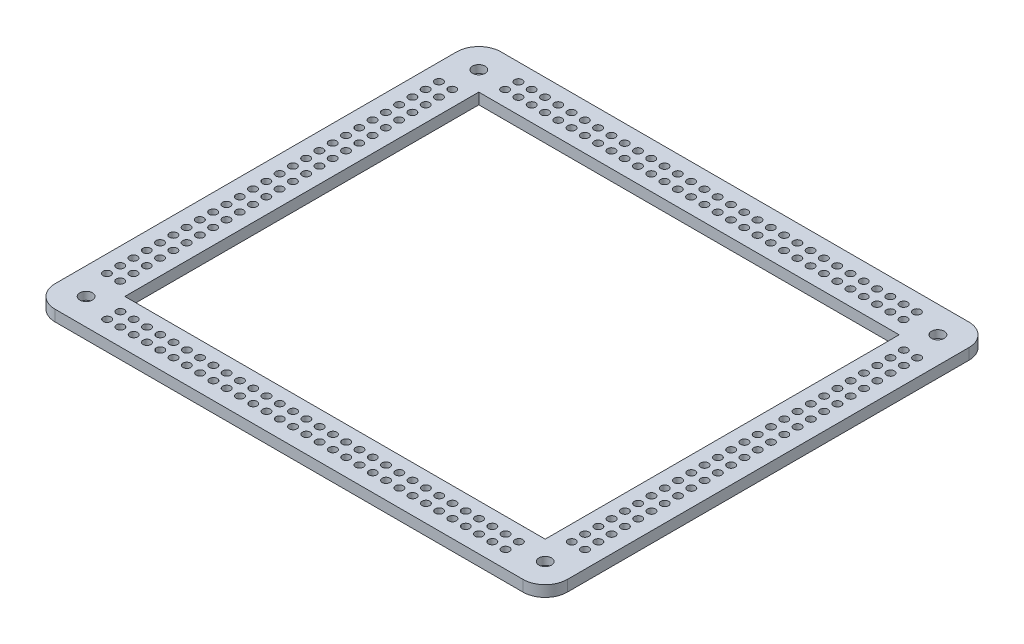
from build123d import *

# Parameters (mm, degrees)
SKETCH1_W               = 231.4
SKETCH1_H               = 201.4
SKETCH1_W_2             = 189.9
SKETCH1_H_2             = 159.9
BOSS_EXTRUDE1_DEPTH     = 5
FILLET1_R               = 10
SKETCH2_R               = 5.85
BOSS_EXTRUDE2_DEPTH     = 2.5
SKETCH3_R               = 1.55
CUT_EXTRUDE1_DEPTH      = 7.5
SKETCH4_R               = 2.85
CUT_EXTRUDE2_DEPTH      = 3.5
MIRROR4_COPY_1_SKETCH_R = 5.85
MIRROR4_COPY_1_DEPTH    = 2.5
MIRROR4_COPY_2_SKETCH_R = 1.55
MIRROR4_COPY_2_DEPTH    = 7.5
MIRROR4_COPY_3_SKETCH_R = 2.85
MIRROR4_COPY_3_DEPTH    = 3.5
MIRROR4_COPY_4_SKETCH_R = 5.85
MIRROR4_COPY_4_DEPTH    = 2.5
MIRROR4_COPY_5_SKETCH_R = 1.55
MIRROR4_COPY_5_DEPTH    = 7.5
MIRROR4_COPY_6_SKETCH_R = 2.85
MIRROR4_COPY_6_DEPTH    = 3.5
SKETCH5_R               = 1.75
CUT_EXTRUDE3_DEPTH      = 5
SKETCH6_R               = 1.75
CUT_EXTRUDE4_DEPTH      = 5


with BuildPart() as part:
    # Sketch1 → Boss-Extrude1 (new body)
    with BuildSketch(Plane(origin=(0, 0, 0), x_dir=(1, 0, 0), z_dir=(0, 1, 0))):
        Rectangle(SKETCH1_W, SKETCH1_H)
        Rectangle(SKETCH1_W_2, SKETCH1_H_2, mode=Mode.SUBTRACT)
    extrude(amount=BOSS_EXTRUDE1_DEPTH)

    # Fillet1
    fillet1_edges = [part.edges().sort_by_distance(p)[0] for p in [
        (-115.7, 2.5, -100.7),
        (115.7, 2.5, -100.7),
        (115.7, 2.5, 100.7),
        (-115.7, 2.5, 100.7),
    ]]
    fillet(fillet1_edges, radius=FILLET1_R)

    # Sketch2 → Boss-Extrude2 (add)
    with BuildSketch(Plane.XZ):
        with Locations((-103.7, 88.7)):
            Circle(SKETCH2_R)
    boss_extrude2 = extrude(amount=BOSS_EXTRUDE2_DEPTH)

    # Sketch3 → Cut-Extrude1 (cut)
    with BuildSketch(Plane(origin=(0, 5, 0), x_dir=(1, 0, 0), z_dir=(0, 1, 0))):
        with Locations((-103.7, -88.7)):
            Circle(SKETCH3_R)
    cut_extrude1 = extrude(amount=-CUT_EXTRUDE1_DEPTH, mode=Mode.SUBTRACT)

    # Sketch4 → Cut-Extrude2 (cut)
    with BuildSketch(Plane(origin=(0, 5, 0), x_dir=(1, 0, 0), z_dir=(0, 1, 0))):
        with Locations((-103.7, -88.7)):
            Circle(SKETCH4_R)
    cut_extrude2 = extrude(amount=-CUT_EXTRUDE2_DEPTH, mode=Mode.SUBTRACT)

    # Mirror3: Boss-Extrude2, Cut-Extrude1, Cut-Extrude2 across plane
    add(boss_extrude2.mirror(Plane(origin=(0, 0, 0), x_dir=(0, 0, 1), z_dir=(1, 0, 0))))
    add(cut_extrude1.mirror(Plane(origin=(0, 0, 0), x_dir=(0, 0, 1), z_dir=(1, 0, 0))), mode=Mode.SUBTRACT)
    add(cut_extrude2.mirror(Plane(origin=(0, 0, 0), x_dir=(0, 0, 1), z_dir=(1, 0, 0))), mode=Mode.SUBTRACT)

    # Mirror4 copy 1 sketch → Mirror4 copy 1 (add)
    with BuildSketch(Plane(origin=(0, 0, 0), x_dir=(-1, 0, 0), z_dir=(0, -1, 0))):
        with Locations((-103.7, 88.7)):
            Circle(MIRROR4_COPY_1_SKETCH_R)
    extrude(amount=MIRROR4_COPY_1_DEPTH)

    # Mirror4 copy 2 sketch → Mirror4 copy 2 (cut)
    with BuildSketch(Plane(origin=(0, 5, 0), x_dir=(-1, 0, 0), z_dir=(0, 1, 0))):
        with Locations((-103.7, -88.7)):
            Circle(MIRROR4_COPY_2_SKETCH_R)
    extrude(amount=-MIRROR4_COPY_2_DEPTH, mode=Mode.SUBTRACT)

    # Mirror4 copy 3 sketch → Mirror4 copy 3 (cut)
    with BuildSketch(Plane(origin=(0, 5, 0), x_dir=(-1, 0, 0), z_dir=(0, 1, 0))):
        with Locations((-103.7, -88.7)):
            Circle(MIRROR4_COPY_3_SKETCH_R)
    extrude(amount=-MIRROR4_COPY_3_DEPTH, mode=Mode.SUBTRACT)

    # Mirror4 copy 4 sketch → Mirror4 copy 4 (add)
    with BuildSketch(Plane.XZ):
        with Locations((-103.7, -88.7)):
            Circle(MIRROR4_COPY_4_SKETCH_R)
    extrude(amount=MIRROR4_COPY_4_DEPTH)

    # Mirror4 copy 5 sketch → Mirror4 copy 5 (cut)
    with BuildSketch(Plane(origin=(0, 5, 0), x_dir=(1, 0, 0), z_dir=(0, 1, 0))):
        with Locations((-103.7, 88.7)):
            Circle(MIRROR4_COPY_5_SKETCH_R)
    extrude(amount=-MIRROR4_COPY_5_DEPTH, mode=Mode.SUBTRACT)

    # Mirror4 copy 6 sketch → Mirror4 copy 6 (cut)
    with BuildSketch(Plane(origin=(0, 5, 0), x_dir=(1, 0, 0), z_dir=(0, 1, 0))):
        with Locations((-103.7, 88.7)):
            Circle(MIRROR4_COPY_6_SKETCH_R)
    extrude(amount=-MIRROR4_COPY_6_DEPTH, mode=Mode.SUBTRACT)

    # Sketch5 → Cut-Extrude3 (cut)
    with BuildSketch(Plane(origin=(0, 5, 0), x_dir=(1, 0, 0), z_dir=(0, 1, 0))):
        with Locations((-90, -86.9)):
            Circle(SKETCH5_R)
        with Locations((-90, -92.9)):
            Circle(SKETCH5_R)
        with Locations((-84, -86.9)):
            Circle(SKETCH5_R)
        with Locations((-84, -92.9)):
            Circle(SKETCH5_R)
        with Locations((-78, -86.9)):
            Circle(SKETCH5_R)
        with Locations((-78, -92.9)):
            Circle(SKETCH5_R)
        with Locations((-72, -86.9)):
            Circle(SKETCH5_R)
        with Locations((-72, -92.9)):
            Circle(SKETCH5_R)
        with Locations((-66, -86.9)):
            Circle(SKETCH5_R)
        with Locations((-66, -92.9)):
            Circle(SKETCH5_R)
        with Locations((-60, -86.9)):
            Circle(SKETCH5_R)
        with Locations((-60, -92.9)):
            Circle(SKETCH5_R)
        with Locations((-54, -86.9)):
            Circle(SKETCH5_R)
        with Locations((-54, -92.9)):
            Circle(SKETCH5_R)
        with Locations((-48, -86.9)):
            Circle(SKETCH5_R)
        with Locations((-48, -92.9)):
            Circle(SKETCH5_R)
        with Locations((-42, -86.9)):
            Circle(SKETCH5_R)
        with Locations((-42, -92.9)):
            Circle(SKETCH5_R)
        with Locations((-36, -86.9)):
            Circle(SKETCH5_R)
        with Locations((-36, -92.9)):
            Circle(SKETCH5_R)
        with Locations((-30, -86.9)):
            Circle(SKETCH5_R)
        with Locations((-30, -92.9)):
            Circle(SKETCH5_R)
        with Locations((-24, -86.9)):
            Circle(SKETCH5_R)
        with Locations((-24, -92.9)):
            Circle(SKETCH5_R)
        with Locations((-18, -86.9)):
            Circle(SKETCH5_R)
        with Locations((-18, -92.9)):
            Circle(SKETCH5_R)
        with Locations((-12, -86.9)):
            Circle(SKETCH5_R)
        with Locations((-12, -92.9)):
            Circle(SKETCH5_R)
        with Locations((-6, -86.9)):
            Circle(SKETCH5_R)
        with Locations((-6, -92.9)):
            Circle(SKETCH5_R)
        with Locations((0, -86.9)):
            Circle(SKETCH5_R)
        with Locations((0, -92.9)):
            Circle(SKETCH5_R)
        with Locations((6, -86.9)):
            Circle(SKETCH5_R)
        with Locations((6, -92.9)):
            Circle(SKETCH5_R)
        with Locations((12, -86.9)):
            Circle(SKETCH5_R)
        with Locations((12, -92.9)):
            Circle(SKETCH5_R)
        with Locations((18, -86.9)):
            Circle(SKETCH5_R)
        with Locations((18, -92.9)):
            Circle(SKETCH5_R)
        with Locations((24, -86.9)):
            Circle(SKETCH5_R)
        with Locations((24, -92.9)):
            Circle(SKETCH5_R)
        with Locations((30, -86.9)):
            Circle(SKETCH5_R)
        with Locations((30, -92.9)):
            Circle(SKETCH5_R)
        with Locations((36, -86.9)):
            Circle(SKETCH5_R)
        with Locations((36, -92.9)):
            Circle(SKETCH5_R)
        with Locations((42, -86.9)):
            Circle(SKETCH5_R)
        with Locations((42, -92.9)):
            Circle(SKETCH5_R)
        with Locations((48, -86.9)):
            Circle(SKETCH5_R)
        with Locations((48, -92.9)):
            Circle(SKETCH5_R)
        with Locations((54, -86.9)):
            Circle(SKETCH5_R)
        with Locations((54, -92.9)):
            Circle(SKETCH5_R)
        with Locations((60, -86.9)):
            Circle(SKETCH5_R)
        with Locations((60, -92.9)):
            Circle(SKETCH5_R)
        with Locations((66, -86.9)):
            Circle(SKETCH5_R)
        with Locations((66, -92.9)):
            Circle(SKETCH5_R)
        with Locations((72, -86.9)):
            Circle(SKETCH5_R)
        with Locations((72, -92.9)):
            Circle(SKETCH5_R)
        with Locations((78, -86.9)):
            Circle(SKETCH5_R)
        with Locations((78, -92.9)):
            Circle(SKETCH5_R)
        with Locations((84, -86.9)):
            Circle(SKETCH5_R)
        with Locations((84, -92.9)):
            Circle(SKETCH5_R)
        with Locations((90, -86.9)):
            Circle(SKETCH5_R)
        with Locations((90, -92.9)):
            Circle(SKETCH5_R)
    cut_extrude3 = extrude(amount=-CUT_EXTRUDE3_DEPTH, mode=Mode.SUBTRACT)

    # Mirror5: Cut-Extrude3 across plane
    add(cut_extrude3.mirror(Plane.XY), mode=Mode.SUBTRACT)

    # Sketch6 → Cut-Extrude4 (cut)
    with BuildSketch(Plane(origin=(0, 5, 0), x_dir=(1, 0, 0), z_dir=(0, 1, 0))):
        with Locations((-102, -75)):
            Circle(SKETCH6_R)
        with Locations((-108, -75)):
            Circle(SKETCH6_R)
        with Locations((-102, -69)):
            Circle(SKETCH6_R)
        with Locations((-108, -69)):
            Circle(SKETCH6_R)
        with Locations((-102, -63)):
            Circle(SKETCH6_R)
        with Locations((-108, -63)):
            Circle(SKETCH6_R)
        with Locations((-102, -57)):
            Circle(SKETCH6_R)
        with Locations((-108, -57)):
            Circle(SKETCH6_R)
        with Locations((-102, -51)):
            Circle(SKETCH6_R)
        with Locations((-108, -51)):
            Circle(SKETCH6_R)
        with Locations((-102, -45)):
            Circle(SKETCH6_R)
        with Locations((-108, -45)):
            Circle(SKETCH6_R)
        with Locations((-102, -39)):
            Circle(SKETCH6_R)
        with Locations((-108, -39)):
            Circle(SKETCH6_R)
        with Locations((-102, -33)):
            Circle(SKETCH6_R)
        with Locations((-108, -33)):
            Circle(SKETCH6_R)
        with Locations((-102, -27)):
            Circle(SKETCH6_R)
        with Locations((-108, -27)):
            Circle(SKETCH6_R)
        with Locations((-102, -21)):
            Circle(SKETCH6_R)
        with Locations((-108, -21)):
            Circle(SKETCH6_R)
        with Locations((-102, -15)):
            Circle(SKETCH6_R)
        with Locations((-108, -15)):
            Circle(SKETCH6_R)
        with Locations((-102, -9)):
            Circle(SKETCH6_R)
        with Locations((-108, -9)):
            Circle(SKETCH6_R)
        with Locations((-102, -3)):
            Circle(SKETCH6_R)
        with Locations((-108, -3)):
            Circle(SKETCH6_R)
        with Locations((-102, 3)):
            Circle(SKETCH6_R)
        with Locations((-108, 3)):
            Circle(SKETCH6_R)
        with Locations((-102, 9)):
            Circle(SKETCH6_R)
        with Locations((-108, 9)):
            Circle(SKETCH6_R)
        with Locations((-102, 15)):
            Circle(SKETCH6_R)
        with Locations((-108, 15)):
            Circle(SKETCH6_R)
        with Locations((-102, 21)):
            Circle(SKETCH6_R)
        with Locations((-108, 21)):
            Circle(SKETCH6_R)
        with Locations((-102, 27)):
            Circle(SKETCH6_R)
        with Locations((-108, 27)):
            Circle(SKETCH6_R)
        with Locations((-102, 33)):
            Circle(SKETCH6_R)
        with Locations((-108, 33)):
            Circle(SKETCH6_R)
        with Locations((-102, 39)):
            Circle(SKETCH6_R)
        with Locations((-108, 39)):
            Circle(SKETCH6_R)
        with Locations((-102, 45)):
            Circle(SKETCH6_R)
        with Locations((-108, 45)):
            Circle(SKETCH6_R)
        with Locations((-102, 51)):
            Circle(SKETCH6_R)
        with Locations((-108, 51)):
            Circle(SKETCH6_R)
        with Locations((-102, 57)):
            Circle(SKETCH6_R)
        with Locations((-108, 57)):
            Circle(SKETCH6_R)
        with Locations((-102, 63)):
            Circle(SKETCH6_R)
        with Locations((-108, 63)):
            Circle(SKETCH6_R)
        with Locations((-102, 69)):
            Circle(SKETCH6_R)
        with Locations((-108, 69)):
            Circle(SKETCH6_R)
        with Locations((-102, 75)):
            Circle(SKETCH6_R)
        with Locations((-108, 75)):
            Circle(SKETCH6_R)
    cut_extrude4 = extrude(amount=-CUT_EXTRUDE4_DEPTH, mode=Mode.SUBTRACT)

    # Mirror6: Cut-Extrude4 across plane
    add(cut_extrude4.mirror(Plane(origin=(0, 0, 0), x_dir=(0, 0, 1), z_dir=(1, 0, 0))), mode=Mode.SUBTRACT)


solid = part.part
